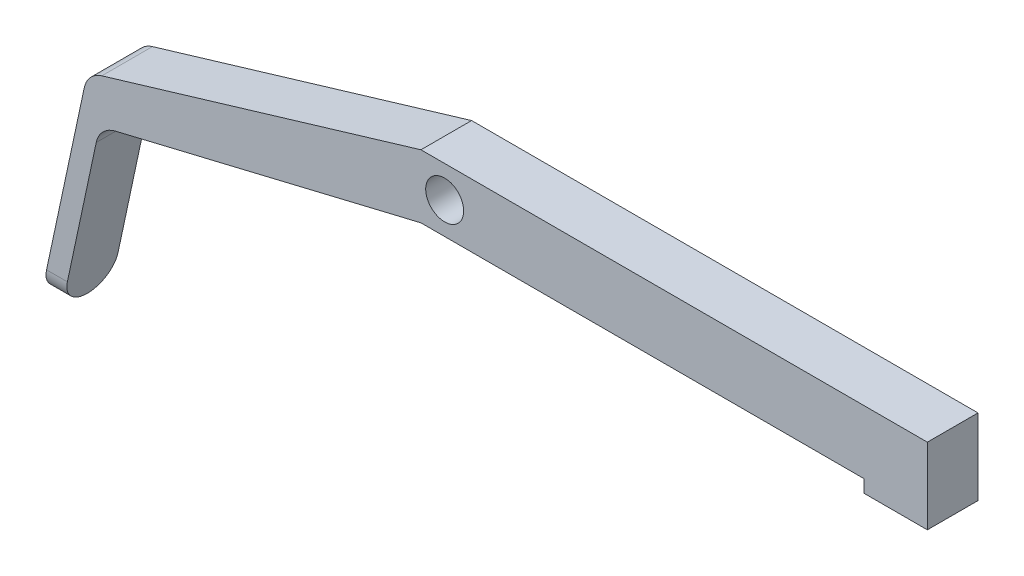
from build123d import *

# Parameters (mm, degrees)
BOSS_EXTRUDE1_DEPTH = 8
SKETCH5_W           = 1.5
SKETCH5_H           = 2.448371941
BOSS_EXTRUDE4_DEPTH = 2
SKETCH6_R           = 3
CUT_EXTRUDE1_DEPTH  = 265.555525233
FILLET1_R           = 4


with BuildPart() as part:
    # Sketch1 → Boss-Extrude1 (new body)
    with BuildSketch(Plane.XY):
        Polygon((-118.155372005, 57.283765903), (-198.155372005, 57.283765903), (-250.845489232, 41.511906575), (-258.155372005, 7.283765903), (-254.866788986, 7.283765903), (-248.926231582, 35.100112729), (-198.155372005, 47.283765903), (-118.155372005, 47.283765903), align=None)
    extrude(amount=BOSS_EXTRUDE1_DEPTH)

    # Sketch5 → Boss-Extrude4 (add)
    with BuildSketch(Plane.XZ.offset(-47.283765903)):
        Polygon((-128.155372005, 6.5), (-119.655372005, 6.5), (-118.155372005, 6.5), (-118.155372005, 8), (-128.155372005, 8), align=None)
        Polygon((-119.655372005, 4.051628059), (-119.655372005, 3.948371941), (-118.155372005, 3.948371941), (-118.155372005, 6.5), (-119.655372005, 6.5), align=None)
        with Locations((-118.905372005, 2.724185971)):
            Rectangle(SKETCH5_W, SKETCH5_H)
        Polygon((-118.155372005, 1.5), (-119.655372005, 1.5), (-128.155372005, 1.5), (-128.155372005, 0), (-118.155372005, 0), align=None)
    extrude(amount=BOSS_EXTRUDE4_DEPTH)

    # Sketch6 → Cut-Extrude1 (cut, through all)
    with BuildSketch(Plane.XY.offset(8)):
        with Locations((-194.405761522, 52.286388284)):
            Circle(SKETCH6_R)
    extrude(amount=-CUT_EXTRUDE1_DEPTH, mode=Mode.SUBTRACT)

    # Fillet1
    fillet1_edges = [part.edges().sort_by_distance(p)[0] for p in [
        (-248.926231582, 35.100112729, 4),
        (-250.845489232, 41.511906575, 4),
        (-256.511080495, 7.283765903, 0),
        (-256.511080495, 7.283765903, 8),
    ]]
    fillet(fillet1_edges, radius=FILLET1_R - 0.0001)  # a hair under: the kernel refuses the full size


solid = part.part
